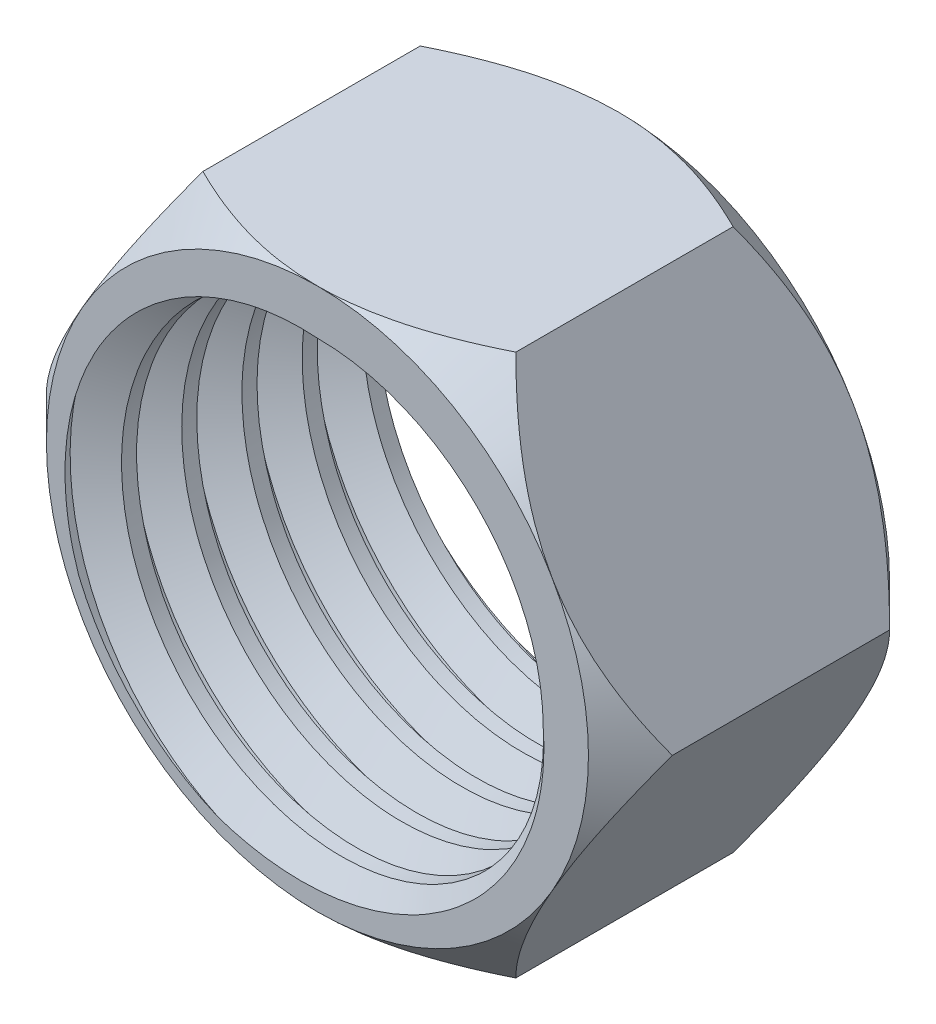
from build123d import *

# Parameters (mm, degrees)
BOSS_EXTRUDE1_DEPTH     = 7
SKETCH2_OUTSIDE_W       = 25.478
SKETCH2_OUTSIDE_H       = 24.086
SKETCH2_OUTSIDE_R       = 4.5
CUT_EXTRUDE1_DEPTH      = 5
CUT_EXTRUDE1_DRAFT      = -45
CUT_EXTRUDE3_DEPTH      = 10.810708435
CUT_EXTRUDE3_DEPTH_BACK = 10.810708435
SKETCH6_R               = 3.75
THREAD2_PITCH           = 1
CUT_EXTRUDE4_DEPTH      = 10.810708552
CUT_EXTRUDE4_DEPTH_BACK = 2
MIRROR2_COPY_1_SKETCH_W = 25.478
MIRROR2_COPY_1_SKETCH_H = 24.086
MIRROR2_COPY_1_SKETCH_R = 4.5
MIRROR2_COPY_1_DEPTH    = 5
MIRROR2_COPY_1_DRAFT    = -45


with BuildPart() as part:
    # Sketch1 → Boss-Extrude1 (new body)
    with BuildSketch(Plane.XY):
        Polygon((5.196152423, 0), (2.598076211, 4.5), (-2.598076211, 4.5), (-5.196152423, 0), (-2.598076211, -4.5), (2.598076211, -4.5), align=None)
    extrude(amount=BOSS_EXTRUDE1_DEPTH)


with BuildPart() as cut_extrude1_tool:
    # Sketch2 outside → Cut-Extrude1 (with draft: the straight prism first)
    with BuildSketch(Plane.XY.offset(7)):
        Rectangle(SKETCH2_OUTSIDE_W, SKETCH2_OUTSIDE_H)
        Circle(SKETCH2_OUTSIDE_R, mode=Mode.SUBTRACT)
    extrude(amount=-CUT_EXTRUDE1_DEPTH)
    # Cut-Extrude1: the draft: its side faces are tilted about the plane it starts from
    cut_extrude1_sides = [cut_extrude1_tool.faces().sort_by_distance(p)[0] for p in [
        (0, -12.043, 4.5),
        (12.739, 0, 4.5),
        (0, 12.043, 4.5),
        (-12.739, 0, 4.5),
        (-4.5, 0, 4.5),
    ]]
    draft(cut_extrude1_sides, Plane.XY.offset(7), CUT_EXTRUDE1_DRAFT)


with BuildPart() as part_1:
    add(part.part)

    # Cut-Extrude1: cut by cut_extrude1_tool
    add(cut_extrude1_tool.part, mode=Mode.SUBTRACT)

    # Sketch6 → Cut-Extrude3 (cut, two sides: drawn at the far end of the back side and taken through both)
    with BuildSketch(Plane.XY.offset(7).offset(-CUT_EXTRUDE3_DEPTH_BACK)):
        Circle(SKETCH6_R)
    extrude(amount=CUT_EXTRUDE3_DEPTH + CUT_EXTRUDE3_DEPTH_BACK, mode=Mode.SUBTRACT)

    # Thread2: the profile of Thread Profile2 profile screwed along a right-hand helix of 7 turns, 8 arcs to a turn; built about Z, then put on its axis
    thread2_z = Axis((0, 0, 0), (0, 0, 1))
    thread2_corners = [(3.7497, 0, -0.000173205), (4.291265875, 0, 0.312499999), (4.291265875, 0, 0.437499999), (3.7497, 0, 0.750173202)]
    with BuildLine(mode=Mode.PRIVATE) as thread2_profile:
        Line(thread2_corners[0], thread2_corners[1])
        Line(thread2_corners[1], thread2_corners[2])
        Line(thread2_corners[2], thread2_corners[3])
        Line(thread2_corners[3], thread2_corners[0])
    thread2_cap = Face(thread2_profile.wire())
    thread2_turn_angles = [0, 22.5, 45, 67.5, 90, 112.5, 135, 157.5, 180, 202.5, 225, 247.5, 270, 292.5, 315, 337.5, 360]
    thread2_turn_weights = [1, 0.9238795325112867, 1, 0.9238795325112867, 1, 0.9238795325112867, 1, 0.9238795325112867, 1, 0.9238795325112867, 1, 0.9238795325112867, 1, 0.9238795325112867, 1, 0.9238795325112867, 1]
    thread2_turn_rails = [Edge.make_bspline([Vector(p[0], p[1], 0).rotate(thread2_z, thread2_turn_angles[k]) / thread2_turn_weights[k] + Vector(0, 0, p[2] + THREAD2_PITCH * thread2_turn_angles[k] / 360) for k in range(17)], [0, 0, 0, 1, 1, 2, 2, 3, 3, 4, 4, 5, 5, 6, 6, 7, 7, 8, 8, 8], 2, thread2_turn_weights) for p in thread2_corners]
    thread2_turn_sides = [Face.make_surface_from_curves(thread2_turn_rails[p[0]], thread2_turn_rails[p[1]]) for p in [(0, 1), (1, 2), (2, 3), (3, 0)]]
    thread2 = Plane(origin=(0, 0, 0), x_dir=(1, 0, 0), z_dir=(0, 0, 1)) * Solid(Shell([*[p.moved(Location((0, 0, THREAD2_PITCH * i))) for i in range(7) for p in thread2_turn_sides], thread2_cap, thread2_cap.rotate(thread2_z, 2520).moved(Location((0, 0, THREAD2_PITCH * 2520 / 360)))]))
    add(thread2, mode=Mode.SUBTRACT)

    # Sketch9 → Cut-Extrude4 (cut, two sides: drawn at the far end of the back side and taken through both)
    with BuildSketch(Plane(origin=(0, 0, 0), x_dir=(-1, 0, 0), z_dir=(0, 0, -1)).offset(-CUT_EXTRUDE4_DEPTH_BACK)):
        Polygon((-5.196152423, 0), (-2.598076211, -4.5), (2.598076211, -4.5), (5.196152423, 0), (2.598076211, 4.5), (-2.598076211, 4.5), align=None)
    extrude(amount=CUT_EXTRUDE4_DEPTH + CUT_EXTRUDE4_DEPTH_BACK, mode=Mode.SUBTRACT)


with BuildPart() as mirror2_copy_1_tool:
    # Mirror2 copy 1 sketch → Mirror2 copy 1 (with draft: the straight prism first)
    with BuildSketch(Plane(origin=(0, 0, 2), x_dir=(1, 0, 0), z_dir=(0, 0, -1))):
        Rectangle(MIRROR2_COPY_1_SKETCH_W, MIRROR2_COPY_1_SKETCH_H)
        Circle(MIRROR2_COPY_1_SKETCH_R, mode=Mode.SUBTRACT)
    extrude(amount=-MIRROR2_COPY_1_DEPTH)
    # Mirror2 copy 1: the draft: its side faces are tilted about the plane it starts from
    mirror2_copy_1_sides = [mirror2_copy_1_tool.faces().sort_by_distance(p)[0] for p in [
        (0, -12.043, 4.5),
        (12.739, 0, 4.5),
        (0, 12.043, 4.5),
        (-12.739, 0, 4.5),
        (-4.5, 0, 4.5),
    ]]
    draft(mirror2_copy_1_sides, Plane(origin=(0, 0, 2), x_dir=(1, 0, 0), z_dir=(0, 0, -1)), MIRROR2_COPY_1_DRAFT)


with BuildPart() as part_2:
    add(part_1.part)

    # Mirror2 copy 1: cut by mirror2_copy_1_tool
    add(mirror2_copy_1_tool.part, mode=Mode.SUBTRACT)


solid = part_2.part
